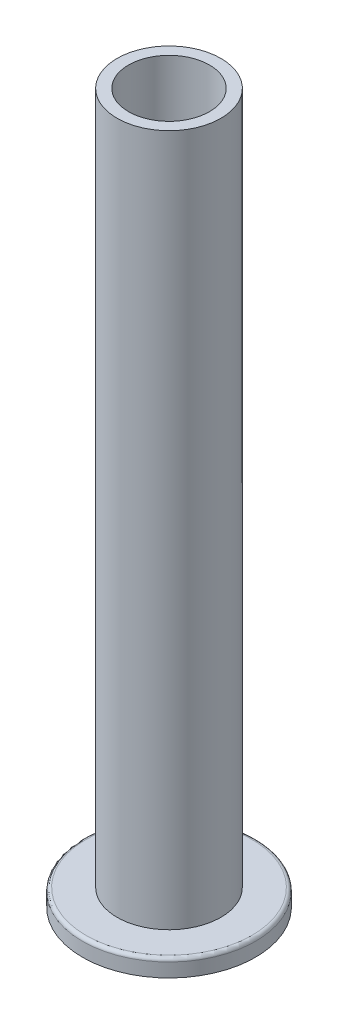
from build123d import *

# Parameters (mm, degrees)
FILLET2_R          = 1
SKETCH2_R          = 11.696559432
CUT_EXTRUDE1_DEPTH = 209.026440627


with BuildPart() as part:
    # Sketch1 → Revolve1 (revolve)
    with BuildSketch(Plane.XY):
        Polygon((0, 0), (0, 200), (15, 200), (15, 0), (25, 0), (25, -5), (0, -5), align=None)
    revolve(axis=Axis((0, 0, 0), (0, 1, 0)))

    # Fillet2
    fillet2_edges = [part.edges().sort_by_distance(p)[0] for p in [
        (-25, 0, 0),
    ]]
    fillet(fillet2_edges, radius=FILLET2_R)

    # Sketch2 → Cut-Extrude1 (cut, through all)
    with BuildSketch(Plane(origin=(0, 200, 0), x_dir=(1, 0, 0), z_dir=(0, 1, 0))):
        Circle(SKETCH2_R)
    extrude(amount=-CUT_EXTRUDE1_DEPTH, mode=Mode.SUBTRACT)


solid = part.part
